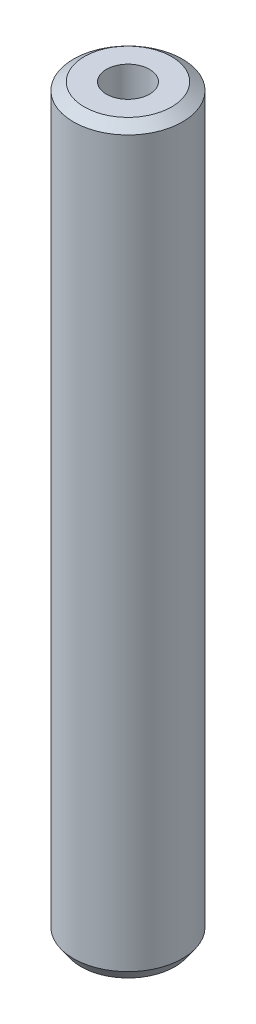
from build123d import *
from OCP.BRepFilletAPI import BRepFilletAPI_MakeChamfer

# Parameters (mm, degrees)
SKETCH1_R           = 20
BOSS_EXTRUDE1_DEPTH = 272.645993296
SKETCH2_R           = 7.912737649
CUT_EXTRUDE1_DEPTH  = 275.109171062
CHAMFER1_SIZE       = 2.78172729
CHAMFER1_SIZE2      = 3.98251103


with BuildPart() as part:
    # Sketch1 → Boss-Extrude1 (new body)
    with BuildSketch(Plane(origin=(0, 0, 0), x_dir=(1, 0, 0), z_dir=(0, 1, 0))):
        Circle(SKETCH1_R)
    extrude(amount=BOSS_EXTRUDE1_DEPTH)

    # Sketch2 → Cut-Extrude1 (cut, through all)
    with BuildSketch(Plane(origin=(0, 0, 0), x_dir=(1, 0, 0), z_dir=(0, 1, 0))):
        Circle(SKETCH2_R)
    extrude(amount=CUT_EXTRUDE1_DEPTH, mode=Mode.SUBTRACT)

    # Chamfer1: one chamfer whose edges measure the first distance from different faces: ONE call of the kernel's chamfer builder (chamfer() names one face for all edges)
    chamfer1_edges_1 = [part.edges().sort_by_distance(p)[0] for p in [
        (-20, 272.645993296, 0),
    ]]
    chamfer1_side_1 = [part.faces().sort_by_distance(p)[0] for p in [
        (-20, 136.322996648, 0),
    ]]
    chamfer1_edges_2 = [part.edges().sort_by_distance(p)[0] for p in [
        (-20, 0, 0),
    ]]
    chamfer1_side_2 = [part.faces().sort_by_distance(p)[0] for p in [
        (-19.434314575, 0, 0),
    ]]
    chamfer1 = BRepFilletAPI_MakeChamfer(part.part.solid().wrapped)
    for e in chamfer1_edges_1:
        chamfer1.Add(CHAMFER1_SIZE, CHAMFER1_SIZE2, e.wrapped, chamfer1_side_1[0].wrapped)  # the first distance lies on this face
    for e in chamfer1_edges_2:
        chamfer1.Add(CHAMFER1_SIZE, CHAMFER1_SIZE2, e.wrapped, chamfer1_side_2[0].wrapped)  # the first distance lies on this face
    add(Compound.cast(chamfer1.Shape()), mode=Mode.REPLACE)


solid = part.part
